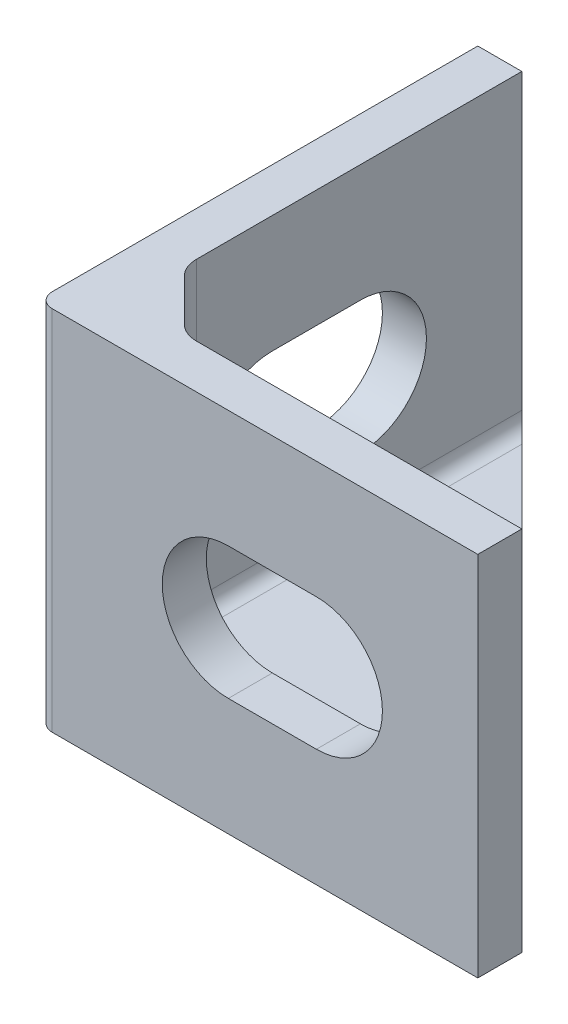
from build123d import *

# Parameters (mm, degrees)
SKETCH_2_W          = 30
SKETCH_2_H          = 25
EXTRUDE_1_DEPTH     = 3
SKETCH_1_W          = 30
SKETCH_1_H          = 25
EXTRUDE_2_DEPTH     = 3
SKETCH_3_W          = 27
SKETCH_3_H          = 4
EXTRUDE_3_DEPTH     = 27
CUT_EXTRUDE_1_DEPTH = 27
FILLET_1_R          = 1
CHAMFER_1_SIZE      = 4
FILLET_2_R          = 2
FILLET_3_R          = 1


with BuildPart() as part:
    # 스케치2 → 보스-돌출1 (new body)
    with BuildSketch(Plane(origin=(0, 0, 0), x_dir=(0, 0, -1), z_dir=(1, 0, 0))):
        with Locations((15, 0)):
            Rectangle(SKETCH_2_W, SKETCH_2_H)
        with BuildLine():
            ThreePointArc((13, -4.5), (8.5, 0), (13, 4.5))
            Line((13, 4.5), (19, 4.5))
            ThreePointArc((19, 4.5), (22.181980515, 3.181980515), (23.5, 0))
            ThreePointArc((23.5, 0), (22.181980515, -3.181980515), (19, -4.5))
            Line((19, -4.5), (13, -4.5))
        make_face(mode=Mode.SUBTRACT)
    extrude(amount=EXTRUDE_1_DEPTH)

    # 스케치1 → 보스-돌출2 (add)
    with BuildSketch(Plane.XY):
        with Locations((15, 0)):
            Rectangle(SKETCH_1_W, SKETCH_1_H)
        with BuildLine():
            ThreePointArc((13, -4.5), (8.5, 0), (13, 4.5))
            Line((13, 4.5), (19, 4.5))
            ThreePointArc((19, 4.5), (22.181980515, 3.181980515), (23.5, 0))
            ThreePointArc((23.5, 0), (22.181980515, -3.181980515), (19, -4.5))
            Line((19, -4.5), (13, -4.5))
        make_face(mode=Mode.SUBTRACT)
    extrude(amount=-EXTRUDE_2_DEPTH)

    # 스케치3 → 보스-돌출3 (add)
    with BuildSketch(Plane(origin=(0, 0, -3), x_dir=(-1, 0, 0), z_dir=(0, 0, -1))):
        with Locations((-16.5, -10.5)):
            Rectangle(SKETCH_3_W, SKETCH_3_H)
    extrude(amount=EXTRUDE_3_DEPTH)

    # 스케치5 → 컷-돌출1 (cut)
    with BuildSketch(Plane(origin=(0, -8.5, 0), x_dir=(1, 0, 0), z_dir=(0, 1, 0))):
        Polygon((3, 30), (30, 3), (30, 30), align=None)
    extrude(amount=-CUT_EXTRUDE_1_DEPTH, mode=Mode.SUBTRACT)

    # 필렛1
    fillet_1_edges = [part.edges().sort_by_distance(p)[0] for p in [
        (0, 0, 0),
    ]]
    fillet(fillet_1_edges, radius=FILLET_1_R)

    # 모따기1
    chamfer_1_edges = [part.edges().sort_by_distance(p)[0] for p in [
        (3, 2, -3),
    ]]
    chamfer(chamfer_1_edges, length=CHAMFER_1_SIZE)

    # 필렛2
    fillet_2_edges = [part.edges().sort_by_distance(p)[0] for p in [
        (7, 2, -3),
        (3, 2, -7),
    ]]
    fillet(fillet_2_edges, radius=FILLET_2_R)

    # 필렛3
    fillet_3_edges = [part.edges().sort_by_distance(p)[0] for p in [
        (18.914213562, -8.5, -3),
        (7.06306026, -8.5, -3.152240935),
        (5, -8.5, -5),
        (3.152240935, -8.5, -7.06306026),
        (3, -8.5, -18.914213562),
    ]]
    fillet(fillet_3_edges, radius=FILLET_3_R)


solid = part.part
